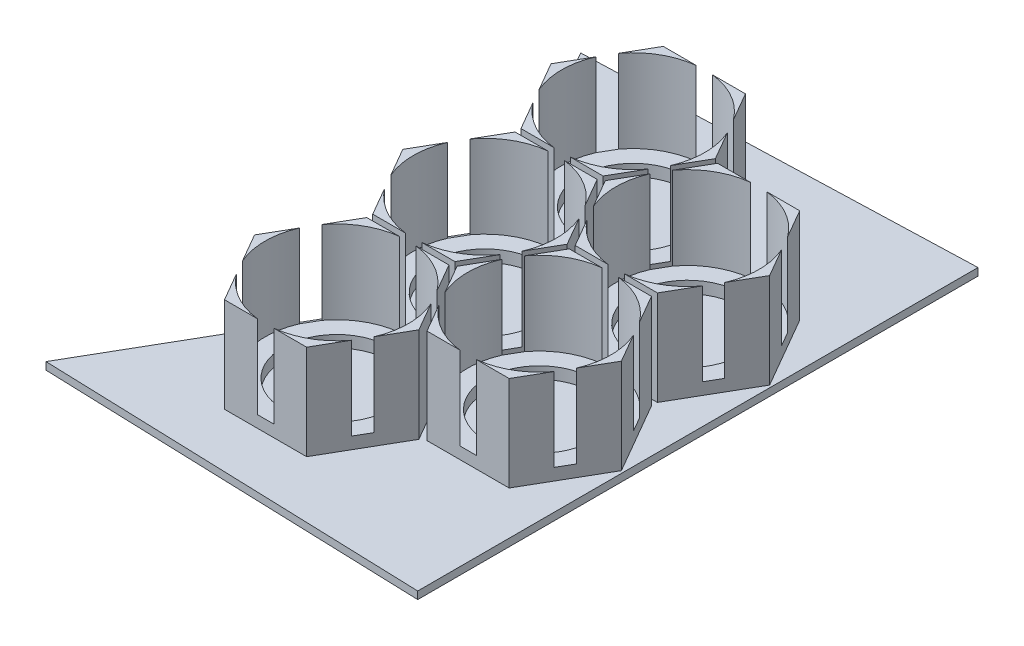
from build123d import *

# Parameters (mm, degrees)
BOSS_EXTRUDE1_DEPTH = 1
BOSS_EXTRUDE2_DEPTH = 25.4
SKETCH4_R           = 14.351
CUT_EXTRUDE1_DEPTH  = 25.4
SKETCH4_4_R         = 19.177
CUT_EXTRUDE2_DEPTH  = 22.225
LPATTERN1_COUNT     = 3
LPATTERN1_PITCH     = 78
SPLIT3_START        = -1
SPLIT3_DEPTH        = 27.4


# Read off the part's stored shape, not the designer's step: Split3
with BuildPart() as part:
    # Sketch1 → Boss-Extrude1 (new, symmetric)
    with BuildSketch(Plane(origin=(0, 0, 0), x_dir=(1, 0, 0), z_dir=(0, 1, 0))):
        Polygon((118, 0), (-118, 0), (-118, -67.135), (118, -75), align=None)
        Polygon((-118, 67.135), (-118, 0), (118, 0), (118, 75), align=None)
    extrude(amount=BOSS_EXTRUDE1_DEPTH, both=True)

    # Sketch3 → Boss-Extrude2 (add)
    with BuildSketch(Plane(origin=(0, 1, 0), x_dir=(1, 0, 0), z_dir=(0, 1, 0))):
        Polygon((-84.001477372, 20.6375), (-73.002954744, 39.6875), (-84.001477372, 58.7375), (-105.998522628, 58.7375), (-116.997045256, 39.6875), (-105.998522628, 20.6375), align=None)
        Polygon((-38.632571531, 19.84375), (-49.631094159, 0.79375), (-71.628139415, 0.79375), (-82.626662043, 19.84375), (-71.628139415, 38.89375), (-49.631094159, 38.89375), align=None)
        Polygon((-84.001477372, -19.05), (-73.002954744, 0), (-84.001477372, 19.05), (-105.998522628, 19.05), (-116.997045256, 0), (-105.998522628, -19.05), align=None)
        Polygon((-105.998522628, -58.7375), (-84.001477372, -58.7375), (-73.002954744, -39.6875), (-84.001477372, -20.6375), (-105.998522628, -20.6375), (-116.997045256, -39.6875), align=None)
        Polygon((-71.628139415, -38.89375), (-49.631094159, -38.89375), (-38.632571531, -19.84375), (-49.631094159, -0.79375), (-71.628139415, -0.79375), (-82.626662043, -19.84375), align=None)
    boss_extrude2 = extrude(amount=BOSS_EXTRUDE2_DEPTH)

    # Sketch4 → Cut-Extrude1 (cut)
    with BuildSketch(Plane(origin=(0, 26.4, 0), x_dir=(1, 0, 0), z_dir=(0, 1, 0))):
        with Locations(Location((-95, 0, 0), (0, 0, 270))):
            Circle(SKETCH4_R)
        with Locations(Location((-95, -39.6875, 0), (0, 0, 270))):
            Circle(SKETCH4_R)
        with Locations(Location((-95, 39.6875, 0), (0, 0, 90))):
            Circle(SKETCH4_R)
        with Locations(Location((-60.629616787, 19.84375, 0), (0, 0, 270))):
            Circle(SKETCH4_R)
        with Locations(Location((-60.629616787, -19.84375, 0), (0, 0, 90))):
            Circle(SKETCH4_R)
    cut_extrude1 = extrude(amount=-CUT_EXTRUDE1_DEPTH, mode=Mode.SUBTRACT)

    # Sketch4<4> → Cut-Extrude2 (cut)
    with BuildSketch(Plane(origin=(0, 26.4, 0), x_dir=(1, 0, 0), z_dir=(0, 1, 0))):
        with Locations((-95, 0)):
            Circle(SKETCH4_4_R)
        with Locations((-95, -39.6875)):
            Circle(SKETCH4_4_R)
        with Locations((-95, 39.6875)):
            Circle(SKETCH4_4_R)
        with Locations((-60.629616787, 19.84375)):
            Circle(SKETCH4_4_R)
        with Locations((-60.629616787, -19.84375)):
            Circle(SKETCH4_4_R)
    cut_extrude2 = extrude(amount=-CUT_EXTRUDE2_DEPTH, mode=Mode.SUBTRACT)

    # LPattern1: Boss-Extrude2, Cut-Extrude1, Cut-Extrude2 ×3
    with Locations(*[(i * LPATTERN1_PITCH, 0, 0) for i in range(1, LPATTERN1_COUNT)]):
        add(boss_extrude2)
        add(cut_extrude1, mode=Mode.SUBTRACT)
        add(cut_extrude2, mode=Mode.SUBTRACT)

    # Split3 outline → Split3 (cut)
    with BuildSketch(Plane(origin=(0, 0, 0), x_dir=(1, 0, 0), z_dir=(0, 1, 0)).offset(SPLIT3_START)):
        Polygon((15.04996756, -71.5690593), (44.913588808, -19.84375), (33.456794404, 0), (44.913588808, 19.84375), (15.04996756, 71.5690593), (-118, 67.135), (-118, -67.135), align=None)
    extrude(amount=SPLIT3_DEPTH, mode=Mode.SUBTRACT)


solid = part.part
